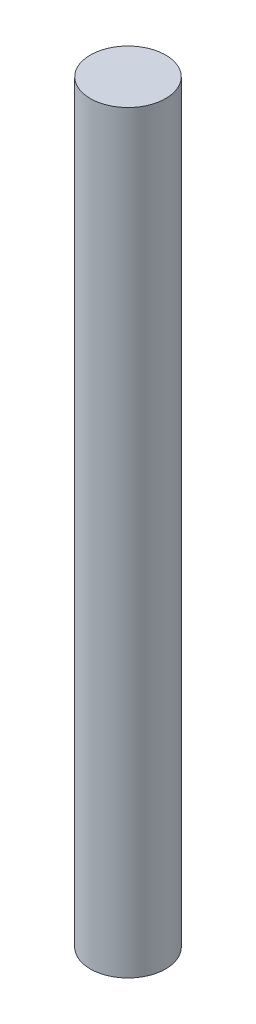
from build123d import *

# Parameters (mm, degrees)
SKETCH1_R           = 5
BOSS_EXTRUDE1_DEPTH = 100


with BuildPart() as part:
    # Sketch1 → Boss-Extrude1 (new body)
    with BuildSketch(Plane(origin=(0, 0, 0), x_dir=(1, 0, 0), z_dir=(0, 1, 0))):
        Circle(SKETCH1_R)
    extrude(amount=BOSS_EXTRUDE1_DEPTH)


solid = part.part
